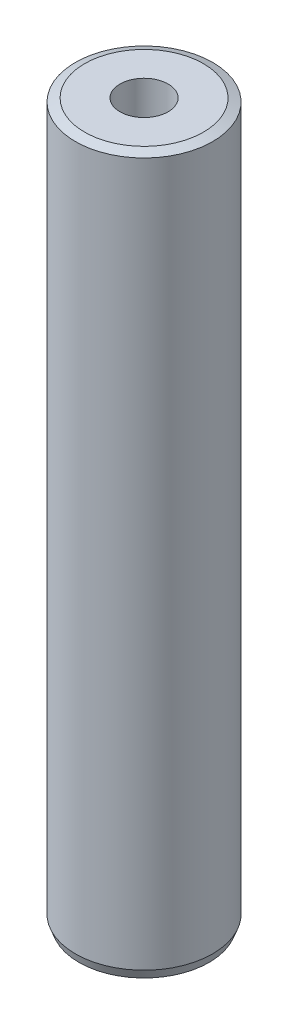
from build123d import *
from OCP.BRepFilletAPI import BRepFilletAPI_MakeChamfer

# Parameters (mm, degrees)
SKETCH1_R           = 57.5
BOSS_EXTRUDE1_DEPTH = 600
SKETCH2_R           = 20.187140497
CUT_EXTRUDE1_DEPTH  = 606.485342515
CHAMFER1_SIZE       = 2.963195438
CHAMFER1_SIZE2      = 7.746216181


with BuildPart() as part:
    # Sketch1 → Boss-Extrude1 (new body)
    with BuildSketch(Plane(origin=(0, 0, 0), x_dir=(1, 0, 0), z_dir=(0, 1, 0))):
        Circle(SKETCH1_R)
    extrude(amount=BOSS_EXTRUDE1_DEPTH)

    # Sketch2 → Cut-Extrude1 (cut, through all)
    with BuildSketch(Plane(origin=(0, 0, 0), x_dir=(1, 0, 0), z_dir=(0, 1, 0))):
        Circle(SKETCH2_R)
    extrude(amount=CUT_EXTRUDE1_DEPTH, mode=Mode.SUBTRACT)

    # Chamfer1: one chamfer whose edges measure the first distance from different faces: ONE call of the kernel's chamfer builder (chamfer() names one face for all edges)
    chamfer1_edges_1 = [part.edges().sort_by_distance(p)[0] for p in [
        (-57.5, 600, 0),
    ]]
    chamfer1_side_1 = [part.faces().sort_by_distance(p)[0] for p in [
        (-57.5, 300, 0),
    ]]
    chamfer1_edges_2 = [part.edges().sort_by_distance(p)[0] for p in [
        (-57.5, 0, 0),
    ]]
    chamfer1_side_2 = [part.faces().sort_by_distance(p)[0] for p in [
        (-55.873654403, 0, 0),
    ]]
    chamfer1 = BRepFilletAPI_MakeChamfer(part.part.solid().wrapped)
    for e in chamfer1_edges_1:
        chamfer1.Add(CHAMFER1_SIZE, CHAMFER1_SIZE2, e.wrapped, chamfer1_side_1[0].wrapped)  # the first distance lies on this face
    for e in chamfer1_edges_2:
        chamfer1.Add(CHAMFER1_SIZE, CHAMFER1_SIZE2, e.wrapped, chamfer1_side_2[0].wrapped)  # the first distance lies on this face
    add(Compound.cast(chamfer1.Shape()), mode=Mode.REPLACE)


solid = part.part
